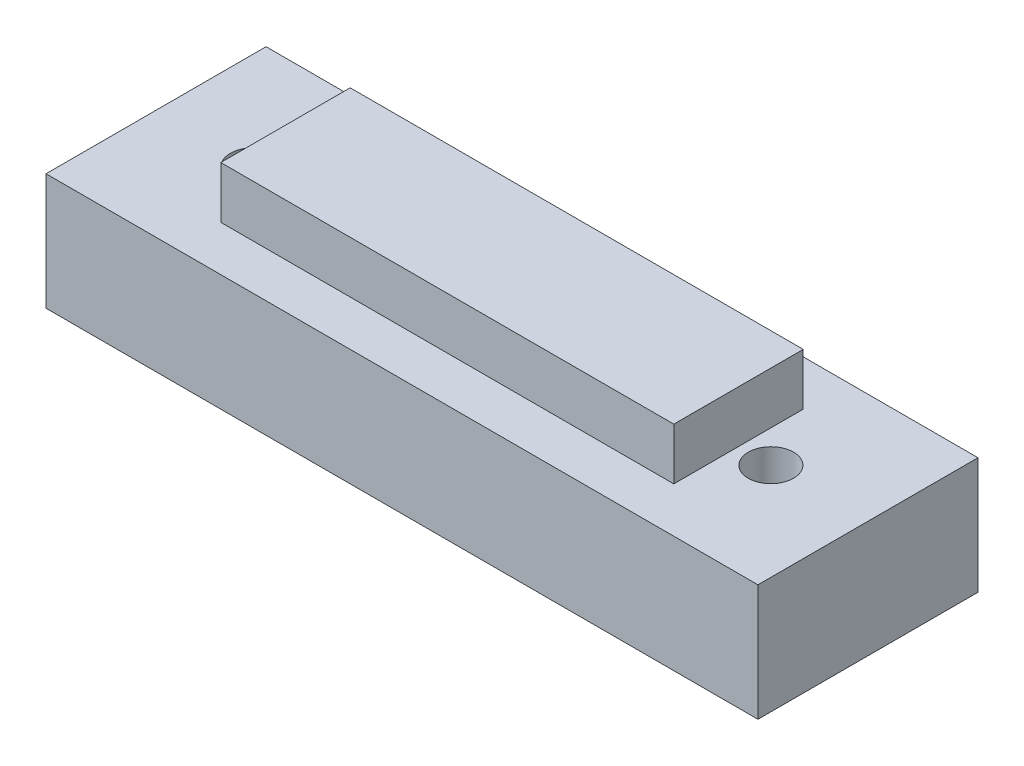
from build123d import *

# Parameters (mm, degrees)
F_01_BASE_PROFILE_W           = 110
F_01_BASE_PROFILE_H           = 34
F_01_BASE_PROFILE_R           = 3.5
F_01_BASE_EXTRUDE_DEPTH       = 18
F_02_BOSS_PROFILE_W           = 70
F_02_BOSS_PROFILE_H           = 20
F_02_REINFORCEMENT_BOSS_DEPTH = 26


with BuildPart() as part:
    # 01_Base_Profile → 01_Base_Extrude (new body)
    with BuildSketch(Plane(origin=(0, 0, 0), x_dir=(1, 0, 0), z_dir=(0, 1, 0))):
        Rectangle(F_01_BASE_PROFILE_W, F_01_BASE_PROFILE_H)
        with Locations((-40, 0)):
            Circle(F_01_BASE_PROFILE_R, mode=Mode.SUBTRACT)
        with Locations((40, 0)):
            Circle(F_01_BASE_PROFILE_R, mode=Mode.SUBTRACT)
    extrude(amount=F_01_BASE_EXTRUDE_DEPTH)

    # 02_Boss_Profile → 02_Reinforcement_Boss (add)
    with BuildSketch(Plane(origin=(0, 0, 0), x_dir=(1, 0, 0), z_dir=(0, 1, 0))):
        Rectangle(F_02_BOSS_PROFILE_W, F_02_BOSS_PROFILE_H)
    extrude(amount=F_02_REINFORCEMENT_BOSS_DEPTH)


solid = part.part
